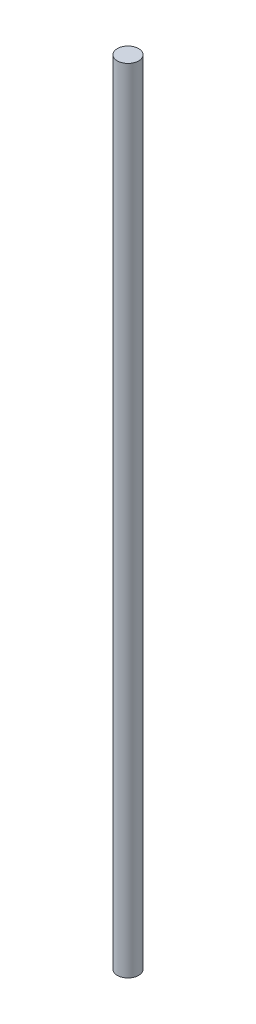
from build123d import *

# Parameters (mm, degrees)
SKETCH1_R           = 5
BOSS_EXTRUDE1_DEPTH = 371.36


with BuildPart() as part:
    # Sketch1 → Boss-Extrude1 (new body)
    with BuildSketch(Plane(origin=(0, 0, 0), x_dir=(1, 0, 0), z_dir=(0, 1, 0))):
        Circle(SKETCH1_R)
    extrude(amount=BOSS_EXTRUDE1_DEPTH)


solid = part.part
